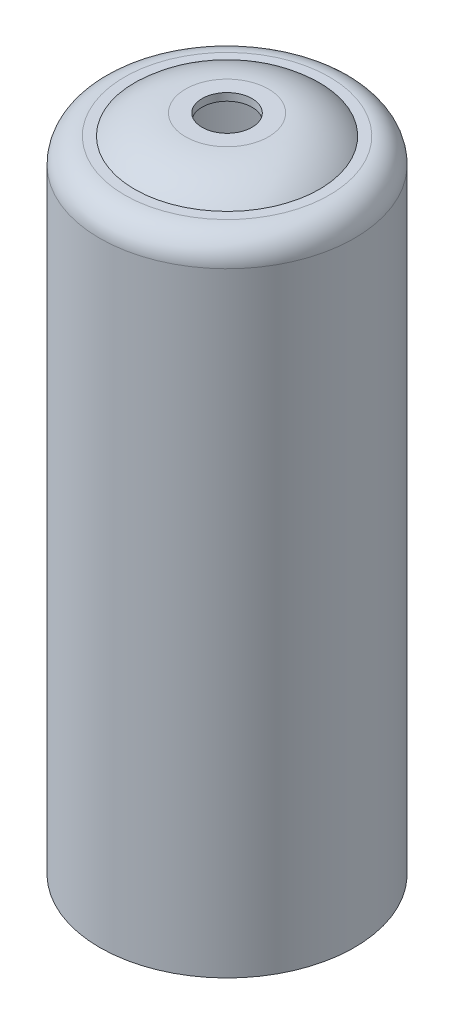
from build123d import *

# Parameters (mm, degrees)
SKETCH1_R           = 25.5
BOSS_EXTRUDE1_DEPTH = 128
FILLET2_R           = 5
SKETCH2_R           = 18.5
BOSS_EXTRUDE2_DEPTH = 4
FILLET5_R           = 15
SKETCH3_R           = 5
CUT_EXTRUDE1_DEPTH  = 137.83749488


# Read off the part's stored shape, not the designer's step: Shell1
with BuildPart() as part:
    # Sketch1 → Boss-Extrude1 (new body)
    with BuildSketch(Plane(origin=(0, 0, 0), x_dir=(1, 0, 0), z_dir=(0, 1, 0))):
        with Locations(Location((0, 0, 0), (0, 0, 270))):
            Circle(SKETCH1_R)
    extrude(amount=BOSS_EXTRUDE1_DEPTH)

    # Fillet2
    fillet2_edges = [part.edges().sort_by_distance(p)[0] for p in [
        (0, 128, -25.5),
    ]]
    fillet(fillet2_edges, radius=FILLET2_R)

    # Sketch2 → Boss-Extrude2 (add)
    with BuildSketch(Plane(origin=(0, 128, 0), x_dir=(1, 0, 0), z_dir=(0, 1, 0))):
        with Locations(Location((0, 0, 0), (0, 0, 270))):
            Circle(SKETCH2_R)
    extrude(amount=BOSS_EXTRUDE2_DEPTH)

    # Fillet5
    # the kernel refuses this fillet: 15 mm, written as the material it takes off along each edge
    with BuildSketch(Plane(origin=(0, 132, 0), x_dir=(0, 0, 1), z_dir=(-1, 0, 0))) as fillet5_piece_1:
        with BuildLine():
            CenterArc((8.301960973, -15), FILLET5_R, 47.166571934, 42.833428066)
            Line((8.301960973, 0), (8.301960973, 0.3))
            Line((8.301960973, 0.3), (18.5, 0.3))
            Line((18.5, 0.3), (18.8, 0))
            ThreePointArc((18.8, 0), (18.8, -2), (18.703960781, -3.78))
            Line((18.703960781, -3.78), (18.5, -4))
        make_face()
    revolve(axis=Axis((0, 132, 0), (0, 1, 0)), mode=Mode.SUBTRACT)

    # Shell1 outline → Shell1 (revolve, cut)
    with BuildSketch(Plane.XY):
        with BuildLine():
            Line((24, 0), (24, 123))
            ThreePointArc((24, 123), (22.974873734, 125.474873734), (20.5, 126.5))
            Line((20.5, 126.5), (17.893624019, 126.5))
            ThreePointArc((17.893624019, 126.5), (13.498113395, 129.459935794), (8.301960973, 130.5))
            Line((8.301960973, 130.5), (0, 130.5))
            Line((0, 130.5), (0, 0))
            Line((0, 0), (24, 0))
        make_face()
    revolve(axis=Axis((0, 0, 0), (0, 1, 0)), mode=Mode.SUBTRACT)

    # Sketch3 → Cut-Extrude1 (cut, through all)
    with BuildSketch(Plane(origin=(0, 132, 0), x_dir=(1, 0, 0), z_dir=(0, 1, 0))):
        with Locations(Location((0, 0, 0), (0, 0, 270))):
            Circle(SKETCH3_R)
    extrude(amount=-CUT_EXTRUDE1_DEPTH, mode=Mode.SUBTRACT)


solid = part.part
